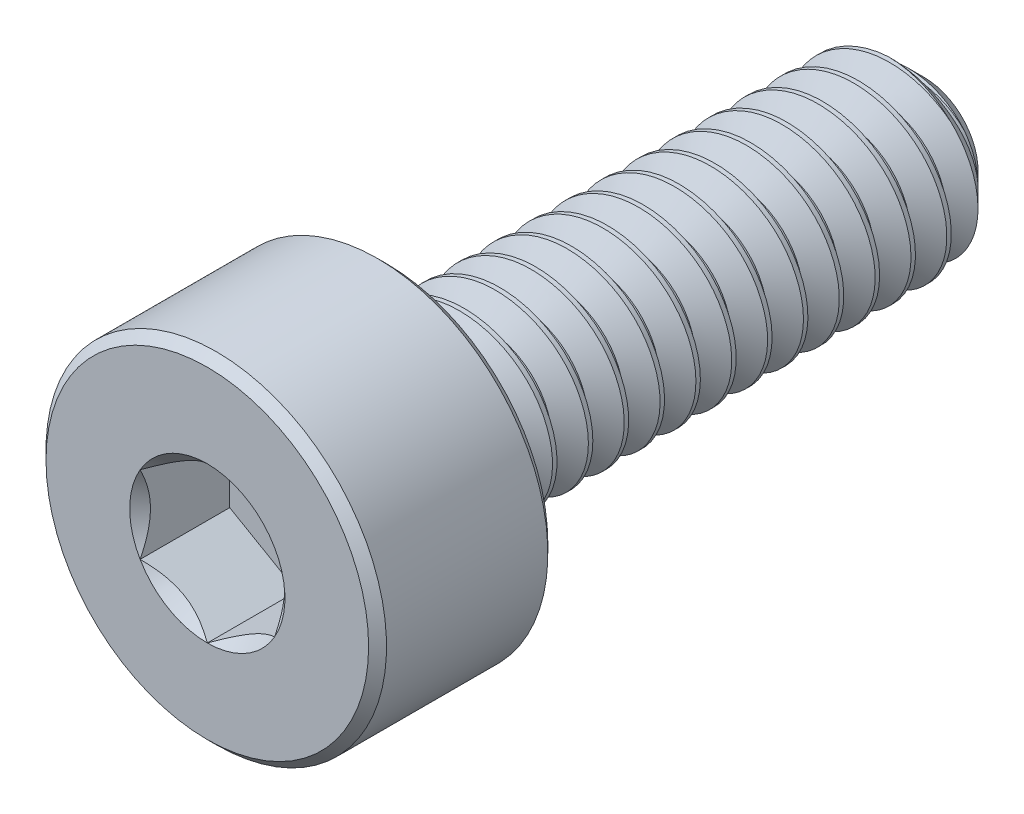
from build123d import *

# Parameters (mm, degrees)
CUT_EXTRUDE1_DEPTH = 1
CUT_SWEEP1_PITCH   = 0.4
CUT_SWEEP1_TO      = 6


with BuildPart() as part:
    # Sketch2 → Revolve1 (revolve)
    with BuildSketch(Plane(origin=(0, 0, 0), x_dir=(0, 0, -1), z_dir=(1, 0, 0))):
        Polygon((-4, 0), (-4, 1.8), (-3.9, 1.9), (-2.1, 1.9), (-2, 1.8), (-2, 1), (3.6, 1), (4, 0.6), (4, 0), align=None)
    revolve(axis=Axis((0, 0, -4), (0, 0, 1)))

    # Sketch3 → Cut-Extrude1 (cut)
    with BuildSketch(Plane.XY.offset(4)):
        Polygon((0.75, -0.433012702), (0.75, 0.433012702), (0, 0.866025404), (-0.75, 0.433012702), (-0.75, -0.433012702), (0, -0.866025404), align=None)
    extrude(amount=-CUT_EXTRUDE1_DEPTH, mode=Mode.SUBTRACT)

    # Cut-Extrude2 cone 1 section (through the dimple's axis) → Cut-Extrude2 (revolve, cut)
    with BuildSketch(Plane(origin=(0, 0, 4), x_dir=(0, -1, 0), z_dir=(1, 0, 0))):
        Polygon((0, 0), (0.866025404, 0), (0, 0.866025404), align=None)
    revolve(axis=Axis((0, 0, 4), (0, 0, -1)), mode=Mode.SUBTRACT)


with BuildPart() as body_2:
    # Split1: read off the stored shape, not the designer's step
    # Split1: the piece on the far side of the plane
    add(part.part)
    split(bisect_by=Plane.XY.offset(2), keep=Keep.BOTTOM)

    # Cut-Sweep1: arcs per turn and ends read off the stored shape
    # Cut-Sweep1: the profile of Sketch7 screwed along a right-hand helix through 16.15 turns, 6 arcs to a turn; built about Z, then put on its axis
    cut_sweep1_z = Axis((0, 0, 0), (0, 0, 1))
    cut_sweep1_corners = [(1.021650635, 0, 0.0125), (1.021650635, 0, -0.3625), (0.740192379, 0, -0.2), (0.740192379, 0, -0.15)]
    with BuildLine(mode=Mode.PRIVATE) as cut_sweep1_profile:
        Line(cut_sweep1_corners[0], cut_sweep1_corners[1])
        Line(cut_sweep1_corners[1], cut_sweep1_corners[2])
        Line(cut_sweep1_corners[2], cut_sweep1_corners[3])
        Line(cut_sweep1_corners[3], cut_sweep1_corners[0])
    cut_sweep1_cap = Face(cut_sweep1_profile.wire())
    cut_sweep1_turn_angles = [0, 30, 60, 90, 120, 150, 180, 210, 240, 270, 300, 330, 360]
    cut_sweep1_turn_weights = [1, 0.8660254037844387, 1, 0.8660254037844387, 1, 0.8660254037844387, 1, 0.8660254037844387, 1, 0.8660254037844387, 1, 0.8660254037844387, 1]
    cut_sweep1_turn_rails = [Edge.make_bspline([Vector(p[0], p[1], 0).rotate(cut_sweep1_z, cut_sweep1_turn_angles[k]) / cut_sweep1_turn_weights[k] + Vector(0, 0, p[2] + CUT_SWEEP1_PITCH * cut_sweep1_turn_angles[k] / 360) for k in range(13)], [0, 0, 0, 1, 1, 2, 2, 3, 3, 4, 4, 5, 5, 6, 6, 6], 2, cut_sweep1_turn_weights) for p in cut_sweep1_corners]
    cut_sweep1_turn_sides = [Face.make_surface_from_curves(cut_sweep1_turn_rails[p[0]], cut_sweep1_turn_rails[p[1]]) for p in [(0, 1), (1, 2), (2, 3), (3, 0)]]
    cut_sweep1_last_angles = [5760, 5787, 5814]
    cut_sweep1_last_weights = [1, 0.891006524188249, 1]
    cut_sweep1_last_rails = [Edge.make_bspline([Vector(p[0], p[1], 0).rotate(cut_sweep1_z, cut_sweep1_last_angles[k]) / cut_sweep1_last_weights[k] + Vector(0, 0, p[2] + CUT_SWEEP1_PITCH * cut_sweep1_last_angles[k] / 360) for k in range(3)], [0, 0, 0, 1, 1, 1], 2, cut_sweep1_last_weights) for p in cut_sweep1_corners]
    cut_sweep1_last_sides = [Face.make_surface_from_curves(cut_sweep1_last_rails[p[0]], cut_sweep1_last_rails[p[1]]) for p in [(0, 1), (1, 2), (2, 3), (3, 0)]]
    cut_sweep1 = Plane(origin=(0, 0, -4), x_dir=(0, 1, 0), z_dir=(0, 0, 1)) * split(Solid(Shell([*[p.moved(Location((0, 0, CUT_SWEEP1_PITCH * i))) for i in range(16) for p in cut_sweep1_turn_sides], *cut_sweep1_last_sides, cut_sweep1_cap, cut_sweep1_cap.rotate(cut_sweep1_z, 5814).moved(Location((0, 0, CUT_SWEEP1_PITCH * 5814 / 360)))])), bisect_by=Plane.XY.offset(CUT_SWEEP1_TO), keep=Keep.BOTTOM, mode=Mode.PRIVATE)
    add(cut_sweep1, mode=Mode.SUBTRACT)


with BuildPart() as part_1:
    add(part.part)

    # Split1
    split(bisect_by=Plane.XY.offset(2), keep=Keep.TOP)

    add(body_2.part)  # Boss-Extrude1 merges body 2
    # Boss-Extrude1: read off the stored shape, not the designer's step
    # Boss-Extrude1 outline → Boss-Extrude1 (revolve)
    with BuildSketch(Plane.XZ):
        Polygon((0.740167909, 2), (0.740167909, 1.740167909), (1, 2), align=None)
    revolve(axis=Axis((0, 0, 0), (0, 0, 1)))


solid = part_1.part
